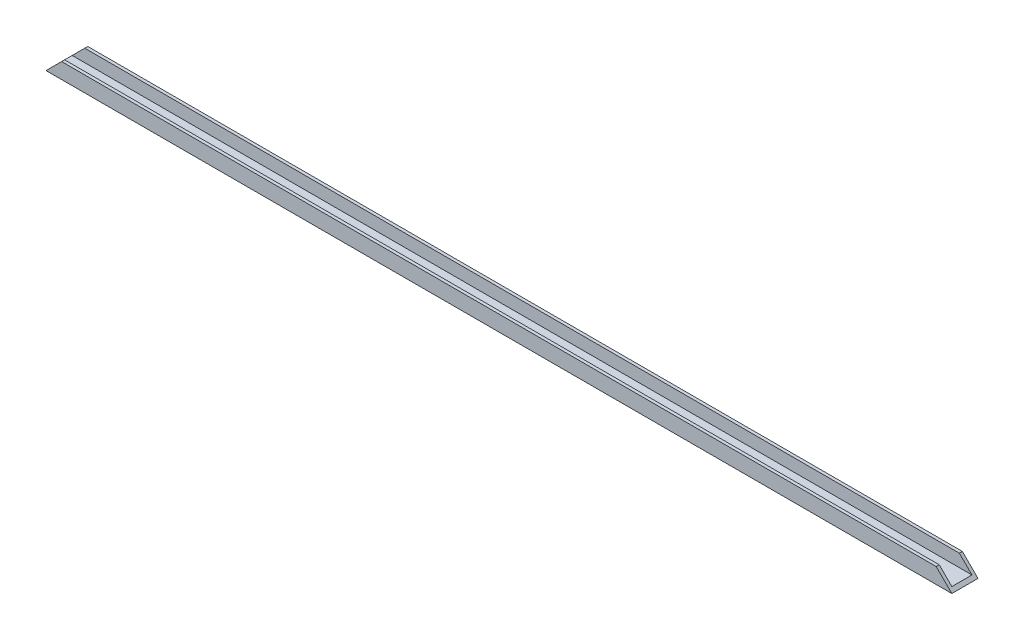
from build123d import *

# Parameters (mm, degrees)
BOSS_EXTRUDE1_DEPTH = 180
CUT_EXTRUDE1_DEPTH  = 181.369509618


with BuildPart() as part:
    # Sketch1 → Boss-Extrude1 (new, symmetric)
    with BuildSketch(Plane(origin=(0, 0, 0), x_dir=(0, 0, -1), z_dir=(1, 0, 0))):
        Polygon((-4, 5), (-4, 0), (4, 0), (4, 5), (5.2, 5), (5.2, -1.2), (-5.2, -1.2), (-5.2, 5), align=None)
    extrude(amount=BOSS_EXTRUDE1_DEPTH, both=True)

    # Sketch3 → Cut-Extrude1 (cut, through all)
    with BuildSketch(Plane.XY.offset(5.2)):
        Polygon((-180, 5), (-180, -1.2), (-173.8, 5), align=None)
        Polygon((180, 5), (180, -1.2), (173.8, 5), align=None)
    extrude(amount=-CUT_EXTRUDE1_DEPTH, mode=Mode.SUBTRACT)


solid = part.part
